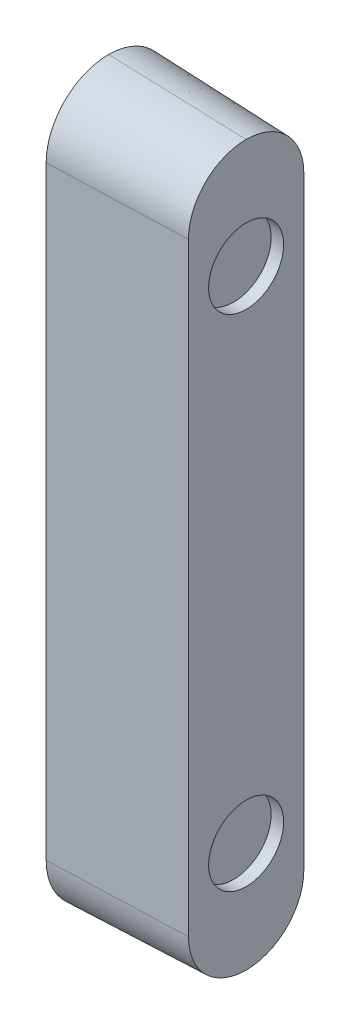
from build123d import *

# Parameters (mm, degrees)
BOSS_EXTRUDE1_DEPTH      = 16.5
BOSS_EXTRUDE1_DEPTH_BACK = 16.5
SKETCH1_W                = 30
SKETCH1_H                = 175
SKETCH2_R                = 9
CUT_EXTRUDE1_DEPTH       = 3
FILLET1_R                = 15
SKETCH3_R                = 4
CUT_EXTRUDE2_DEPTH       = 4
DRAFT1_ANGLE             = -2


with BuildPart() as part:
    # Sketch1 → Boss-Extrude1 (new, two sides: drawn at the far end of the back side and taken through both)
    with BuildSketch(Plane(origin=(0, 0, 0), x_dir=(0, 0, -1), z_dir=(1, 0, 0)).offset(-BOSS_EXTRUDE1_DEPTH_BACK)):
        Rectangle(SKETCH1_W, SKETCH1_H)
    extrude(amount=BOSS_EXTRUDE1_DEPTH + BOSS_EXTRUDE1_DEPTH_BACK)

    # Sketch2 → Cut-Extrude1 (cut)
    with BuildSketch(Plane(origin=(16.5, 0, 0), x_dir=(0, 0, -1), z_dir=(1, 0, 0))):
        with Locations((0, -60)):
            Circle(SKETCH2_R)
        with Locations((0, 60)):
            Circle(SKETCH2_R)
    extrude(amount=-CUT_EXTRUDE1_DEPTH, mode=Mode.SUBTRACT)

    # Fillet1
    fillet1_edges = [part.edges().sort_by_distance(p)[0] for p in [
        (0, 87.5, -15),
        (0, 87.5, 15),
        (0, -87.5, -15),
        (0, -87.5, 15),
    ]]
    fillet(fillet1_edges, radius=FILLET1_R - 0.0001)  # a hair under: the kernel refuses the full size

    # Sketch3 → Cut-Extrude2 (cut)
    with BuildSketch(Plane(origin=(0, 0, -15), x_dir=(-1, 0, 0), z_dir=(0, 0, -1))):
        with Locations((-0.6, 0)):
            Circle(SKETCH3_R)
    extrude(amount=-CUT_EXTRUDE2_DEPTH, mode=Mode.SUBTRACT)

    # Draft1
    draft1_faces = [part.faces().sort_by_distance(p)[0] for p in [
        (0, -83.106631007, -10.606631007),
        (15.012920379, 0, -15),
        (0, 83.106631007, -10.606631007),
        (0, 83.106631007, 10.606631007),
        (0, 0, 15),
        (0, -83.106631007, 10.606631007),
    ]]
    draft(draft1_faces, Plane(origin=(-16.5, 0, 0), x_dir=(0, 0, -1), z_dir=(-1, 0, 0)), DRAFT1_ANGLE)


solid = part.part
